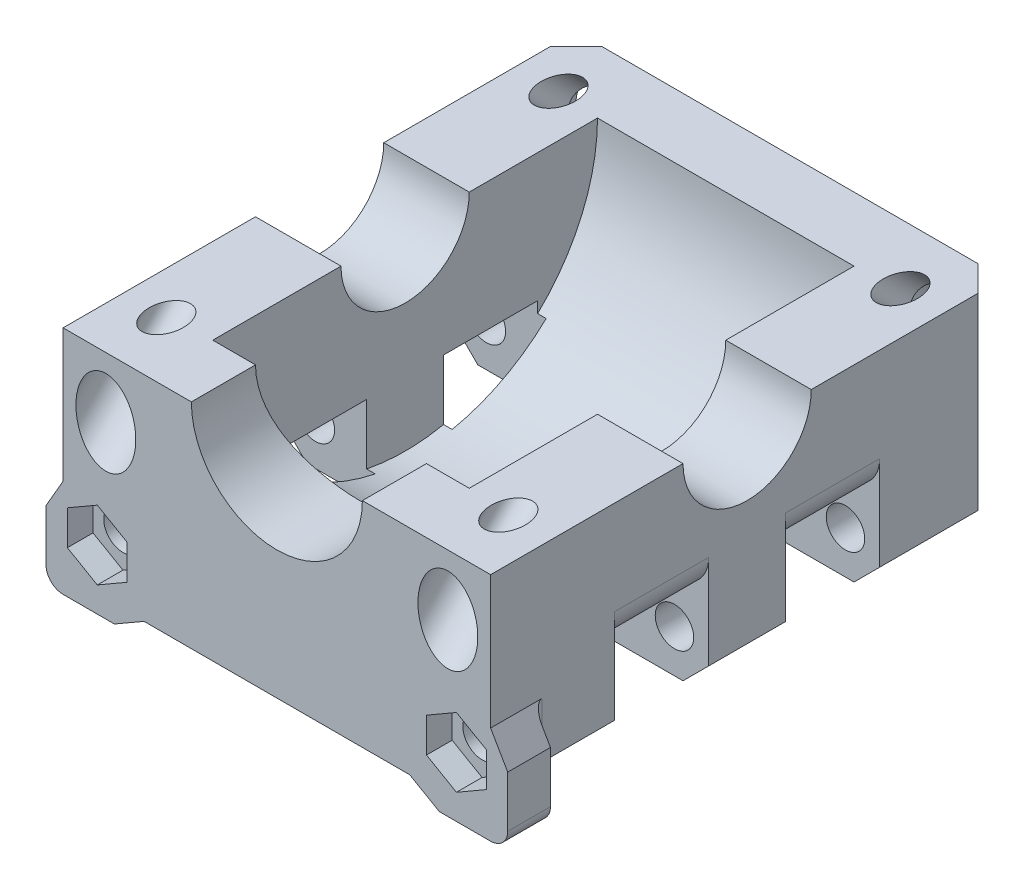
from build123d import *

# Parameters (mm, degrees)
SKETCH1_W           = 50
SKETCH1_H           = 60
BOSS_EXTRUDE1_DEPTH = 25
CUT_EXTRUDE1_START  = -10
SKETCH2_R           = 22.5
CUT_EXTRUDE1_DEPTH  = 30
SKETCH3_R           = 7.5
CUT_EXTRUDE2_DEPTH  = 64.442887702
SKETCH4_R           = 10
CUT_EXTRUDE3_DEPTH  = 10
SKETCH10_W          = 11
SKETCH10_H          = 10
CUT_EXTRUDE9_DEPTH  = 11
SKETCH11_R          = 2.25
CUT_EXTRUDE10_DEPTH = 50.398886748
SKETCH12_R          = 2
CUT_EXTRUDE11_DEPTH = 50.371044201
SKETCH13_R          = 3.5
CUT_EXTRUDE12_DEPTH = 50.371044201
CHAMFER1_SIZE       = 3
FILLET1_R           = 4
SKETCH14_R          = 2
CUT_EXTRUDE13_DEPTH = 10
CUT_EXTRUDE14_DEPTH = 3
BOSS_EXTRUDE2_DEPTH = 5
CHAMFER2_SIZE       = 3
FILLET2_R           = 1


with BuildPart() as part:
    # Sketch1 → Boss-Extrude1 (new body)
    with BuildSketch(Plane(origin=(0, 0, 0), x_dir=(1, 0, 0), z_dir=(0, 1, 0))):
        Rectangle(SKETCH1_W, SKETCH1_H)
    extrude(amount=BOSS_EXTRUDE1_DEPTH)

    # Sketch2 → Cut-Extrude1 (cut)
    with BuildSketch(Plane.ZY.offset(25).offset(CUT_EXTRUDE1_START)):
        with Locations((0, 25)):
            Circle(SKETCH2_R)
    extrude(amount=-CUT_EXTRUDE1_DEPTH, mode=Mode.SUBTRACT)

    # Sketch3 → Cut-Extrude2 (cut, through all)
    with BuildSketch(Plane.ZY.offset(25)):
        with Locations((0, 25)):
            Circle(SKETCH3_R)
    extrude(amount=-CUT_EXTRUDE2_DEPTH, mode=Mode.SUBTRACT)

    # Sketch4 → Cut-Extrude3 (cut)
    with BuildSketch(Plane.XY.offset(30)):
        with Locations((0, 25)):
            Circle(SKETCH4_R)
    extrude(amount=-CUT_EXTRUDE3_DEPTH, mode=Mode.SUBTRACT)

    # Sketch10 → Cut-Extrude9 (cut)
    with BuildSketch(Plane(origin=(25, 0, 0), x_dir=(0, 0, -1), z_dir=(1, 0, 0))):
        with Locations((-10, 5)):
            Rectangle(SKETCH10_W, SKETCH10_H)
        with Locations((10, 5)):
            Rectangle(SKETCH10_W, SKETCH10_H)
    cut_extrude9 = extrude(amount=-CUT_EXTRUDE9_DEPTH, mode=Mode.SUBTRACT)

    # Sketch11 → Cut-Extrude10 (cut, symmetric)
    with BuildSketch(Plane(origin=(0, 0, -4.5), x_dir=(-1, 0, 0), z_dir=(0, 0, -1))):
        with Locations(Location((-21, 5, 0), (0, 0, 90))):
            Circle(SKETCH11_R)
    cut_extrude10 = extrude(amount=CUT_EXTRUDE10_DEPTH, both=True, mode=Mode.SUBTRACT)

    # Mirror1: Cut-Extrude9, Cut-Extrude10 across plane
    add(cut_extrude9.mirror(Plane(origin=(0, 0, 0), x_dir=(0, 0, 1), z_dir=(1, 0, 0))), mode=Mode.SUBTRACT)
    add(cut_extrude10.mirror(Plane(origin=(0, 0, 0), x_dir=(0, 0, 1), z_dir=(1, 0, 0))), mode=Mode.SUBTRACT)

    # Sketch12 → Cut-Extrude11 (cut, symmetric)
    with BuildSketch(Plane(origin=(0, -2.5, 2.5), x_dir=(1, 0, 0), z_dir=(0, -0.7071067811865475, 0.7071067811865477))):
        with Locations(Location((20, 33.890872965, 0), (0, 0, 270))):
            Circle(SKETCH12_R)
        with Locations(Location((-20, 33.890872965, 0), (0, 0, 270))):
            Circle(SKETCH12_R)
    cut_extrude11 = extrude(amount=CUT_EXTRUDE11_DEPTH, both=True, mode=Mode.SUBTRACT)

    # Sketch13 → Cut-Extrude12 (cut, through all)
    with BuildSketch(Plane(origin=(0, -2.5, 2.5), x_dir=(1, 0, 0), z_dir=(0, -0.7071067811865475, 0.7071067811865477))):
        with Locations(Location((-20, 33.890872965, 0), (0, 0, 90))):
            Circle(SKETCH13_R)
        with Locations(Location((20, 33.890872965, 0), (0, 0, 90))):
            Circle(SKETCH13_R)
    cut_extrude12 = extrude(amount=CUT_EXTRUDE12_DEPTH, mode=Mode.SUBTRACT)

    # Mirror3: Cut-Extrude11, Cut-Extrude12 across plane
    add(cut_extrude11.mirror(Plane.XY), mode=Mode.SUBTRACT)
    add(cut_extrude12.mirror(Plane.XY), mode=Mode.SUBTRACT)

    # Chamfer1
    # the kernel refuses this chamfer: 3 mm, written as the material it takes off along each edge
    with BuildSketch(Plane(origin=(25, -7.715048964, -30), x_dir=(-0.9996219169112965, 0, -0.02749587661058676), z_dir=(0, 1, 0))) as chamfer1_piece_1:
        Polygon((CHAMFER1_SIZE * 0.999621916911, CHAMFER1_SIZE * 0.0274958766106), (-CHAMFER1_SIZE * 0.0274958766106, CHAMFER1_SIZE * 0.999621916911), (0, 0), align=None)
    extrude(amount=40.430097928, mode=Mode.SUBTRACT)
    with BuildSketch(Plane(origin=(-25, -7.715048964, -30), x_dir=(0.9996219169112965, 0, -0.02749587661058676), z_dir=(0, 1, 0))) as chamfer1_piece_2:
        Polygon((CHAMFER1_SIZE * 0.999621916911, -CHAMFER1_SIZE * 0.0274958766106), (-CHAMFER1_SIZE * 0.0274958766106, -CHAMFER1_SIZE * 0.999621916911), (0, 0), align=None)
    extrude(amount=40.430097928, mode=Mode.SUBTRACT)

    # Fillet1
    fillet1_edges = [part.edges().sort_by_distance(p)[0] for p in [
        (-25, 10, 10),
        (-25, 10, -10),
        (25, 10, 10),
        (25, 10, -10),
    ]]
    fillet(fillet1_edges, radius=FILLET1_R)

    # Sketch14 → Cut-Extrude13 (cut)
    with BuildSketch(Plane.XZ):
        with Locations(Location((-15, -20.205680561, 0), (0, 0, 270))):
            Circle(SKETCH14_R)
        with Locations(Location((15, -20.205680561, 0), (0, 0, 270))):
            Circle(SKETCH14_R)
    extrude(amount=-CUT_EXTRUDE13_DEPTH, mode=Mode.SUBTRACT)

    # Sketch15 → Cut-Extrude14 (cut)
    with BuildSketch(Plane.XY.offset(30)):
        Polygon((-21, 0.958548116), (-17.5, 2.979274058), (-17.5, 7.020725942), (-21, 9.041451884), (-24.5, 7.020725942), (-24.5, 2.979274058), align=None)
        Polygon((21, 0.958548116), (24.5, 2.979274058), (24.5, 7.020725942), (21, 9.041451884), (17.5, 7.020725942), (17.5, 2.979274058), align=None)
    extrude(amount=-CUT_EXTRUDE14_DEPTH, mode=Mode.SUBTRACT)

    # Sketch16 → Boss-Extrude2 (add)
    with BuildSketch(Plane.XY.offset(30)):
        with BuildLine():
            Line((-25, 9.464101615), (-27, 6))
            Line((-27, 6), (-27, 0))
            ThreePointArc((-27, 0), (-26.414213562, -1.414213562), (-25, -2))
            Line((-25, -2), (-19, -2))
            Line((-19, -2), (-15.535898385, 0))
            Line((-15.535898385, 0), (-25, 0))
            Line((-25, 0), (-25, 9.464101615))
        make_face()
    boss_extrude2 = extrude(amount=-BOSS_EXTRUDE2_DEPTH)

    # Mirror4: Boss-Extrude2 across plane
    add(boss_extrude2.mirror(Plane(origin=(0, 0, 0), x_dir=(0, 0, 1), z_dir=(1, 0, 0))))

    # Chamfer2
    # the kernel refuses this chamfer: 3 mm, written as the material it takes off along each edge
    with BuildSketch(Plane(origin=(-25, 0, 25), x_dir=(0.9996219169112968, -0.02749587661058636, 0), z_dir=(0, 0, -1))) as chamfer2_piece_1:
        Polygon((CHAMFER2_SIZE * 0.999621916911, -CHAMFER2_SIZE * 0.0274958766106), (-CHAMFER2_SIZE * 0.0274958766106, -CHAMFER2_SIZE * 0.999621916911), (0, 0), align=None)
    extrude(amount=17.215048964, mode=Mode.SUBTRACT)
    with BuildSketch(Plane(origin=(-25, 0, 12.215048964), x_dir=(0.9996219169112968, -0.02749587661058636, 0), z_dir=(0, 0, -1))) as chamfer2_piece_2:
        Polygon((CHAMFER2_SIZE * 0.999621916911, -CHAMFER2_SIZE * 0.0274958766106), (-CHAMFER2_SIZE * 0.0274958766106, -CHAMFER2_SIZE * 0.999621916911), (0, 0), align=None)
    extrude(amount=24.430097928, mode=Mode.SUBTRACT)
    with BuildSketch(Plane(origin=(-25, 0, -7.784951036), x_dir=(0.9996219169112968, -0.02749587661058636, 0), z_dir=(0, 0, -1))) as chamfer2_piece_3:
        Polygon((CHAMFER2_SIZE * 0.999621916911, -CHAMFER2_SIZE * 0.0274958766106), (-CHAMFER2_SIZE * 0.0274958766106, -CHAMFER2_SIZE * 0.999621916911), (0, 0), align=None)
    extrude(amount=26.930097928, mode=Mode.SUBTRACT)
    with BuildSketch(Plane(origin=(-16.54463656, 0, -35.45536344), x_dir=(0.7068394360709561, -0.027495876610586396, 0.7068394360703909), z_dir=(-0.7071067811862648, 0, 0.7071067811868302))) as chamfer2_piece_4:
        Polygon((CHAMFER2_SIZE * 0.999621916911, CHAMFER2_SIZE * 0.0274958766106), (-CHAMFER2_SIZE * 0.0274958766106, CHAMFER2_SIZE * 0.999621916911), (0, 0), align=None)
    extrude(amount=19.672738615, mode=Mode.SUBTRACT)
    with BuildSketch(Plane(origin=(-29.715048964, 0, -30), x_dir=(0, -0.02749587661058636, 0.9996219169112968), z_dir=(1, 0, 0))) as chamfer2_piece_5:
        Polygon((CHAMFER2_SIZE * 0.999621916911, -CHAMFER2_SIZE * 0.0274958766106), (-CHAMFER2_SIZE * 0.0274958766106, -CHAMFER2_SIZE * 0.999621916911), (0, 0), align=None)
    extrude(amount=59.430097928, mode=Mode.SUBTRACT)
    with BuildSketch(Plane(origin=(16.54463656, 0, -35.45536344), x_dir=(-0.7068394360709561, -0.027495876610586396, 0.7068394360703909), z_dir=(0.7071067811862648, 0, 0.7071067811868302))) as chamfer2_piece_6:
        Polygon((CHAMFER2_SIZE * 0.999621916911, -CHAMFER2_SIZE * 0.0274958766106), (-CHAMFER2_SIZE * 0.0274958766106, -CHAMFER2_SIZE * 0.999621916911), (0, 0), align=None)
    extrude(amount=19.672738615, mode=Mode.SUBTRACT)
    with BuildSketch(Plane(origin=(25, 0, -34.715048964), x_dir=(0.027495876610586778, 0.9996219169112968, 0), z_dir=(0, 0, 1))) as chamfer2_piece_7:
        Polygon((CHAMFER2_SIZE * 0.999621916911, CHAMFER2_SIZE * 0.0274958766106), (-CHAMFER2_SIZE * 0.0274958766106, CHAMFER2_SIZE * 0.999621916911), (0, 0), align=None)
    extrude(amount=26.930097928, mode=Mode.SUBTRACT)
    with BuildSketch(Plane(origin=(25, 0, 7.784951036), x_dir=(0.027495876610586778, 0.9996219169112968, 0), z_dir=(0, 0, 1))) as chamfer2_piece_8:
        Polygon((CHAMFER2_SIZE * 0.999621916911, CHAMFER2_SIZE * 0.0274958766106), (-CHAMFER2_SIZE * 0.0274958766106, CHAMFER2_SIZE * 0.999621916911), (0, 0), align=None)
    extrude(amount=17.215048964, mode=Mode.SUBTRACT)
    with BuildSketch(Plane(origin=(25, 0, -12.215048964), x_dir=(0.027495876610586778, 0.9996219169112968, 0), z_dir=(0, 0, 1))) as chamfer2_piece_9:
        Polygon((CHAMFER2_SIZE * 0.999621916911, CHAMFER2_SIZE * 0.0274958766106), (-CHAMFER2_SIZE * 0.0274958766106, CHAMFER2_SIZE * 0.999621916911), (0, 0), align=None)
    extrude(amount=24.430097928, mode=Mode.SUBTRACT)

    # Fillet2
    fillet2_edges = [part.edges().sort_by_distance(p)[0] for p in [
        (-18.767949192, 0, 25),
        (18.767949192, 0, 25),
        (-25, 6.232050808, 25),
        (25, 6.232050808, 25),
        (-23.5, 1.5, 25),
        (23.5, 1.5, 25),
    ]]
    fillet(fillet2_edges, radius=FILLET2_R)


solid = part.part
